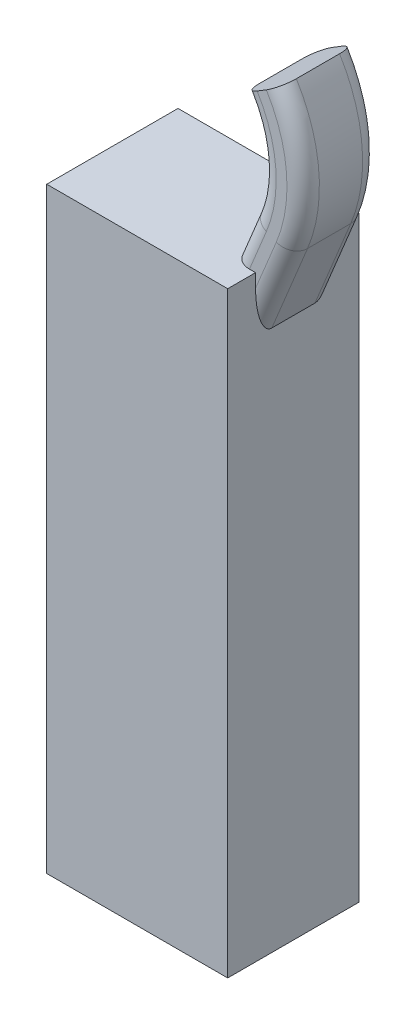
from build123d import *

# Parameters (mm, degrees)
SKETCH1_W   = 33.5
SKETCH1_H   = 110.5
BODY_DEPTH  = 12.15
CABLE_DEPTH = 7
FILLET1_R   = 3


with BuildPart() as part:
    # Sketch1 → Body (new, symmetric)
    with BuildSketch(Plane.XY):
        Rectangle(SKETCH1_W, SKETCH1_H)
    extrude(amount=BODY_DEPTH, both=True)

    # Sketch2 → Cable (add, symmetric)
    with BuildSketch(Plane.XY):
        with BuildLine():
            Line((14.614768377, 39.692127969), (23.378177187, 60.932254406))
            ThreePointArc((23.378177187, 60.932254406), (25.480222235, 74.274540457), (21.310589844, 87.121694079))
            Line((21.310589844, 87.121694079), (14.485707158, 82.94784977))
            ThreePointArc((14.485707158, 82.94784977), (17.505037046, 73.644920573), (15.98289628, 63.98345422))
            Line((15.98289628, 63.98345422), (7.21948747, 42.743327783))
            Line((7.21948747, 42.743327783), (14.614768377, 39.692127969))
        make_face()
    extrude(amount=CABLE_DEPTH, both=True)

    # Fillet1
    fillet1_edges = [part.edges().sort_by_distance(p)[0] for p in [
        (20.064088593, 52.899802391, -7),
        (20.064088593, 52.899802391, 7),
        (14.18123964, 59.61672711, -7),
        (14.18123964, 59.61672711, 7),
        (25.480222235, 74.274540457, -7),
        (25.480222235, 74.274540457, 7),
        (17.505037046, 73.644920573, -7),
        (17.505037046, 73.644920573, 7),
    ]]
    fillet(fillet1_edges, radius=FILLET1_R)


solid = part.part
